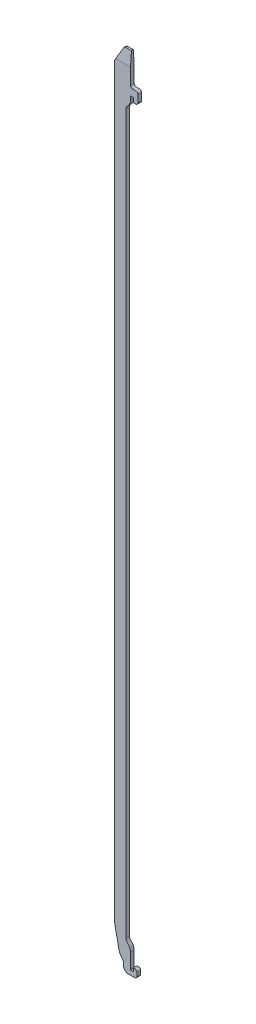
from build123d import *

# Parameters (mm, degrees)
EXTRUDE_1_DEPTH          = 4
CHAMFER_1_SIZE           = 20
CHAMFER_1_SIZE2          = 34.641016151
FILLET_1_R               = 5
SKETCH_2_W               = 20
SKETCH_2_H               = 1568
CUT_EXTRUDE_1_DEPTH      = 1738.371002406
FILLET_2_R               = 20
FILLET_3_R               = 10
CUT_EXTRUDE_2_DEPTH      = 1738.371002406
CUT_EXTRUDE_2_DEPTH_BACK = 1738.371002406
FILLET_4_R               = 10
CHAMFER_START            = -30
CHAMFER_4_OUTLINE_W      = 63
CHAMFER_4_OUTLINE_H      = 8
CHAMFER_4_DEPTH          = 12.643216867
FILLET_6_R               = 30
CUT_EXTRUDE_3_DEPTH      = 1738.357188375


with BuildPart() as part:
    # Эскиз1 → Бобышка-Вытянуть1 (new, symmetric)
    with BuildSketch(Plane.XY):
        Polygon((0, 1653), (6, 1653), (6, 1643), (16, 1643), (16, 1668), (0, 1668), (0, 1737), (-35, 1737), (-35, 0), (14, 0), (14, 17), (6, 17), (6, 10), (0, 10), align=None)
    extrude(amount=EXTRUDE_1_DEPTH, both=True)

    # Фаска1
    chamfer_1_edges = [part.edges().sort_by_distance(p)[0] for p in [
        (-35, 1737, 0),
    ]]
    chamfer_1_side = [part.faces().sort_by_distance(p)[0] for p in [
        (-17.5, 1737, 0),
    ]]
    chamfer(chamfer_1_edges, length=CHAMFER_1_SIZE, length2=CHAMFER_1_SIZE2, reference=chamfer_1_side[0])

    # Скругление1
    fillet_1_edges = [part.edges().sort_by_distance(p)[0] for p in [
        (0, 1668, 0),
        (16, 1668, 0),
        (16, 1643, 0),
        (14, 17, 0),
        (14, 0, 0),
        (-35, 1702.358983849, 0),
        (-15, 1737, 0),
    ]]
    fillet(fillet_1_edges, radius=FILLET_1_R)

    # Эскиз2 → Вырез-Вытянуть1 (cut, through all)
    with BuildSketch(Plane.XY.offset(4)):
        with Locations((0, 844)):
            Rectangle(SKETCH_2_W, SKETCH_2_H)
    extrude(amount=-CUT_EXTRUDE_1_DEPTH, mode=Mode.SUBTRACT)

    # Скругление2
    # the kernel refuses this fillet: 20 mm, written as the material it takes off along each edge
    with BuildSketch(Plane(origin=(0, 1628, 47.301270189), x_dir=(0, 1, 0), z_dir=(0, 0, -1))) as fillet_2_piece_1:
        with BuildLine():
            CenterArc((17.320508076, -20), FILLET_2_R, 90, 60)
            Line((0, -10), (-0.346410162, -9.8))
            ThreePointArc((-0.346410162, -9.8), (-0.4, -5), (-0.4, 0))
            Line((-0.4, 0), (0, 0.4))
            Line((0, 0.4), (17.320508076, 0.4))
            Line((17.320508076, 0.4), (17.320508076, 0))
        make_face()
    extrude(amount=94.602540378, mode=Mode.SUBTRACT)
    with BuildSketch(Plane(origin=(0, 60, -47.301270189), x_dir=(-1, 0, 0), z_dir=(0, 0, 1))) as fillet_2_piece_2:
        with BuildLine():
            CenterArc((20, 17.320508076), FILLET_2_R, 180, 60)
            Line((0, 17.320508076), (-0.4, 17.320508076))
            Line((-0.4, 17.320508076), (-0.4, 0))
            Line((-0.4, 0), (0, -0.4))
            ThreePointArc((0, -0.4), (5, -0.4), (9.8, -0.346410162))
            Line((9.8, -0.346410162), (10, 0))
        make_face()
    extrude(amount=94.602540378, mode=Mode.SUBTRACT)

    # Скругление3
    fillet_3_edges = [part.edges().sort_by_distance(p)[0] for p in [
        (-10, 1628, 0),
        (-10, 60, 0),
    ]]
    fillet(fillet_3_edges, radius=FILLET_3_R)

    # Эскиз3 → Вырез-Вытянуть2 (cut, two sides: drawn at the far end of the back side and taken through both)
    with BuildSketch(Plane.XY.offset(4).offset(-CUT_EXTRUDE_2_DEPTH_BACK)):
        with BuildLine():
            Line((-15, 15), (-15, 0))
            Line((-15, 0), (-47.109663931, 0))
            Line((-47.109663931, 0), (-47.109663931, 63.037421146))
            Line((-47.109663931, 63.037421146), (-35, 63.037421146))
            Line((-35, 63.037421146), (-35, 25))
            Line((-35, 25), (-25, 25))
            ThreePointArc((-25, 25), (-17.928932188, 22.071067812), (-15, 15))
        make_face()
    extrude(amount=CUT_EXTRUDE_2_DEPTH + CUT_EXTRUDE_2_DEPTH_BACK, mode=Mode.SUBTRACT)

    # Скругление4
    fillet_4_edges = [part.edges().sort_by_distance(p)[0] for p in [
        (-15, 0, 0),
    ]]
    fillet(fillet_4_edges, radius=FILLET_4_R)

    # Фаска4: read off the stored shape, not the designer's step
    # Фаска4 outline → Фаска4 (cut)
    with BuildSketch(Plane(origin=(0, 0, 0), x_dir=(-0.2028847643439639, 0.9792026207057936, 0), z_dir=(0.9792026207057936, 0.2028847643439639, 0)).offset(CHAMFER_START)):
        with Locations((58.5, 0)):
            Rectangle(CHAMFER_4_OUTLINE_W, CHAMFER_4_OUTLINE_H)
    extrude(amount=CHAMFER_4_DEPTH, mode=Mode.SUBTRACT)

    # Скругление6
    fillet_6_edges = [part.edges().sort_by_distance(p)[0] for p in [
        (-22.857142857, 24.767710237, 0),
    ]]
    fillet(fillet_6_edges, radius=FILLET_6_R)

    # Эскиз4 → Вырез-Вытянуть3 (cut, through all)
    with BuildSketch(Plane(origin=(0, 0, 0), x_dir=(0, 0, -1), z_dir=(1, 0, 0))):
        Polygon((-4, 1707), (-4, 1737), (-2, 1737), align=None)
    cut_extrude_3 = extrude(amount=-CUT_EXTRUDE_3_DEPTH, mode=Mode.SUBTRACT)

    # Зеркальное отражение1: Вырез-Вытянуть3 across plane
    add(cut_extrude_3.mirror(Plane.XY), mode=Mode.SUBTRACT)


solid = part.part
